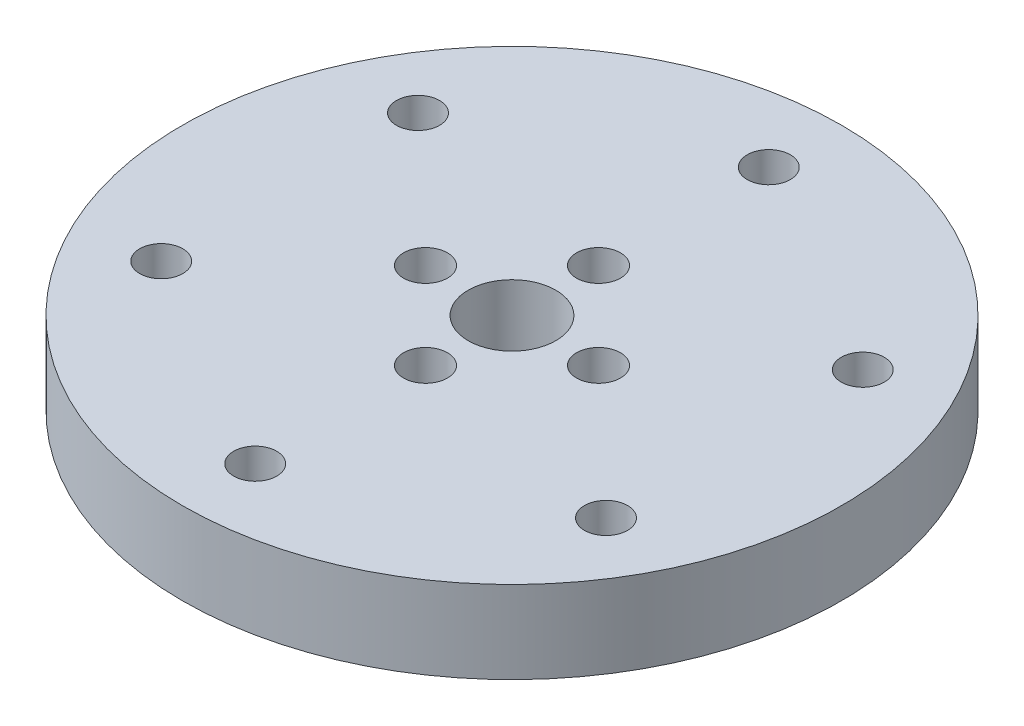
from build123d import *

# Parameters (mm, degrees)
SKETCH1_R           = 30.48
BOSS_EXTRUDE1_DEPTH = 7.62
SKETCH2_R           = 1.9939
CUT_EXTRUDE1_DEPTH  = 44.773567367
CIRPATTERN1_COUNT   = 6
SKETCH3_R           = 4.0513
SKETCH3_R_2         = 2.032
CUT_EXTRUDE2_DEPTH  = 44.773567367
CIRPATTERN2_COUNT   = 4


with BuildPart() as part:
    # Sketch1 → Boss-Extrude1 (new body)
    with BuildSketch(Plane(origin=(0, 0, 0), x_dir=(1, 0, 0), z_dir=(0, 1, 0))):
        Circle(SKETCH1_R)
    extrude(amount=BOSS_EXTRUDE1_DEPTH)

    # Sketch2 → Cut-Extrude1 (cut, through all)
    with BuildSketch(Plane(origin=(0, 7.62, 0), x_dir=(1, 0, 0), z_dir=(0, 1, 0))):
        with Locations((0, -23.749)):
            Circle(SKETCH2_R)
    cut_extrude1 = extrude(amount=-CUT_EXTRUDE1_DEPTH, mode=Mode.SUBTRACT)

    # CirPattern1: Cut-Extrude1 ×6 about axis
    cirpattern1_axis = Axis((0, 7.62, 0), (0, -1, 0))
    for i in range(1, CIRPATTERN1_COUNT):
        add(cut_extrude1.rotate(cirpattern1_axis, i * 360 / CIRPATTERN1_COUNT), mode=Mode.SUBTRACT)

    # Sketch3 → Cut-Extrude2 (cut, through all)
    with BuildSketch(Plane(origin=(0, 7.62, 0), x_dir=(1, 0, 0), z_dir=(0, 1, 0))):
        Circle(SKETCH3_R)
        with Locations((0, -8.001)):
            Circle(SKETCH3_R_2)
    cut_extrude2 = extrude(amount=-CUT_EXTRUDE2_DEPTH, mode=Mode.SUBTRACT)

    # CirPattern2: Cut-Extrude2 ×4 about axis
    cirpattern2_axis = Axis((0, 7.62, 0), (0, -1, 0))
    for i in range(1, CIRPATTERN2_COUNT):
        add(cut_extrude2.rotate(cirpattern2_axis, i * 360 / CIRPATTERN2_COUNT), mode=Mode.SUBTRACT)


solid = part.part
